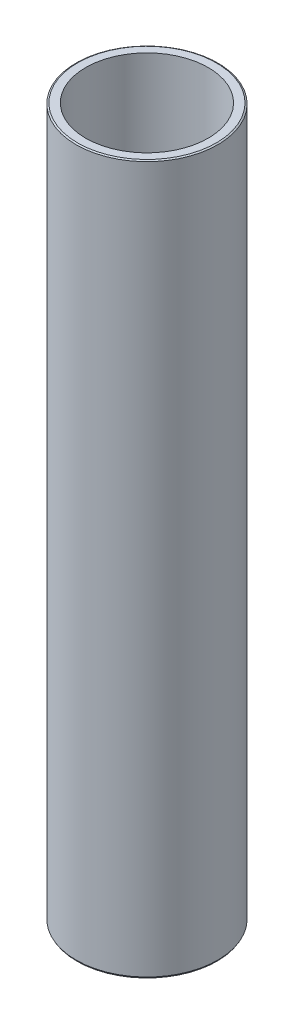
from build123d import *
from OCP.BRepFilletAPI import BRepFilletAPI_MakeChamfer

# Parameters (mm, degrees)
SKETCH1_R           = 60
BOSS_EXTRUDE1_DEPTH = 600
SKETCH2_R           = 51.89250581
CUT_EXTRUDE1_DEPTH  = 606.970296302
CHAMFER1_SIZE       = 0.719744662
CHAMFER1_SIZE2      = 1.246634324


with BuildPart() as part:
    # Sketch1 → Boss-Extrude1 (new body)
    with BuildSketch(Plane(origin=(0, 0, 0), x_dir=(1, 0, 0), z_dir=(0, 1, 0))):
        Circle(SKETCH1_R)
    extrude(amount=BOSS_EXTRUDE1_DEPTH)

    # Sketch2 → Cut-Extrude1 (cut, through all)
    with BuildSketch(Plane(origin=(0, 0, 0), x_dir=(1, 0, 0), z_dir=(0, 1, 0))):
        Circle(SKETCH2_R)
    extrude(amount=CUT_EXTRUDE1_DEPTH, mode=Mode.SUBTRACT)

    # Chamfer1: one chamfer whose edges measure the first distance from different faces: ONE call of the kernel's chamfer builder (chamfer() names one face for all edges)
    chamfer1_edges_1 = [part.edges().sort_by_distance(p)[0] for p in [
        (-60, 600, 0),
    ]]
    chamfer1_side_1 = [part.faces().sort_by_distance(p)[0] for p in [
        (-60, 300, 0),
    ]]
    chamfer1_edges_2 = [part.edges().sort_by_distance(p)[0] for p in [
        (-60, 0, 0),
    ]]
    chamfer1_side_2 = [part.faces().sort_by_distance(p)[0] for p in [
        (-58.302943725, 0, 0),
    ]]
    chamfer1 = BRepFilletAPI_MakeChamfer(part.part.solid().wrapped)
    for e in chamfer1_edges_1:
        chamfer1.Add(CHAMFER1_SIZE, CHAMFER1_SIZE2, e.wrapped, chamfer1_side_1[0].wrapped)  # the first distance lies on this face
    for e in chamfer1_edges_2:
        chamfer1.Add(CHAMFER1_SIZE, CHAMFER1_SIZE2, e.wrapped, chamfer1_side_2[0].wrapped)  # the first distance lies on this face
    add(Compound.cast(chamfer1.Shape()), mode=Mode.REPLACE)


solid = part.part
